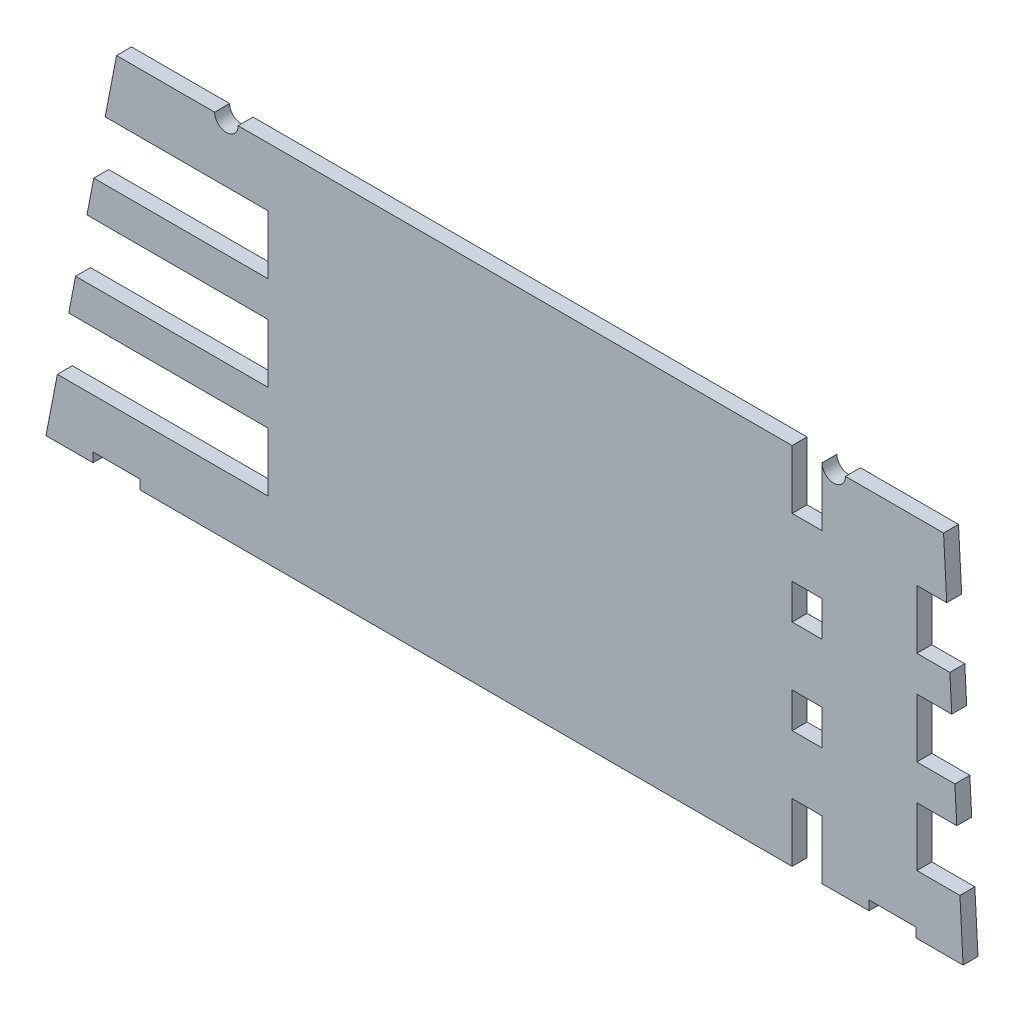
from build123d import *

# Parameters (mm, degrees)
SKETCH1_W      = 12.7
SKETCH1_H      = 15
EXTRUDE1_DEPTH = 6.35


with BuildPart() as part:
    # Sketch1 → Extrude1 (new body)
    with BuildSketch(Plane.XY):
        with BuildLine():
            Line((-159.50625, 4), (-159.50625, 0))
            Line((-159.50625, 0), (117.79375, 0))
            Line((117.79375, 0), (117.79375, 25))
            Line((117.79375, 25), (130.49375, 25))
            Line((130.49375, 25), (130.49375, 0))
            Line((130.49375, 0), (150.49375, 0))
            Line((150.49375, 0), (150.49375, 4))
            Line((150.49375, 4), (170.49375, 4))
            Line((170.49375, 4), (170.49375, 0))
            Line((170.49375, 0), (190.49375, 0))
            Line((190.49375, 0), (189.157056452, 25))
            Line((189.157056452, 25), (170.842943548, 25))
            Line((170.842943548, 25), (170.842943548, 50))
            Line((170.842943548, 50), (187.820362903, 50))
            Line((187.820362903, 50), (187.018346774, 65))
            Line((187.018346774, 65), (170.842943548, 65))
            Line((170.842943548, 65), (170.842943548, 90))
            Line((170.842943548, 90), (185.681653226, 90))
            Line((185.681653226, 90), (184.879637097, 105))
            Line((184.879637097, 105), (170.842943548, 105))
            Line((170.842943548, 105), (170.842943548, 130))
            Line((170.842943548, 130), (183.542943548, 130))
            Line((183.542943548, 130), (182.20625, 155))
            Line((182.20625, 155), (140.49375, 155))
            ThreePointArc((140.49375, 155), (135.49375, 150), (130.49375, 155))
            Line((130.49375, 155), (130.49375, 130))
            Line((130.49375, 130), (117.79375, 130))
            Line((117.79375, 130), (117.79375, 155))
            Line((117.79375, 155), (-117.79375, 155))
            ThreePointArc((-117.79375, 155), (-122.79375, 150), (-127.79375, 155))
            Line((-127.79375, 155), (-169.50625, 155))
            Line((-169.50625, 155), (-174.344959677, 130))
            Line((-174.344959677, 130), (-105.09375, 130))
            Line((-105.09375, 130), (-105.09375, 105))
            Line((-105.09375, 105), (-179.183669355, 105))
            Line((-179.183669355, 105), (-182.086895161, 90))
            Line((-182.086895161, 90), (-105.09375, 90))
            Line((-105.09375, 90), (-105.09375, 65))
            Line((-105.09375, 65), (-186.925604839, 65))
            Line((-186.925604839, 65), (-189.828830645, 50))
            Line((-189.828830645, 50), (-105.09375, 50))
            Line((-105.09375, 50), (-105.09375, 25))
            Line((-105.09375, 25), (-194.667540323, 25))
            Line((-194.667540323, 25), (-199.50625, 0))
            Line((-199.50625, 0), (-179.50625, 0))
            Line((-179.50625, 0), (-179.50625, 4))
            Line((-179.50625, 4), (-159.50625, 4))
        make_face()
        with Locations((124.14375, 57.5)):
            Rectangle(SKETCH1_W, SKETCH1_H, mode=Mode.SUBTRACT)
        with Locations((124.14375, 97.5)):
            Rectangle(SKETCH1_W, SKETCH1_H, mode=Mode.SUBTRACT)
    extrude(amount=EXTRUDE1_DEPTH)


solid = part.part
